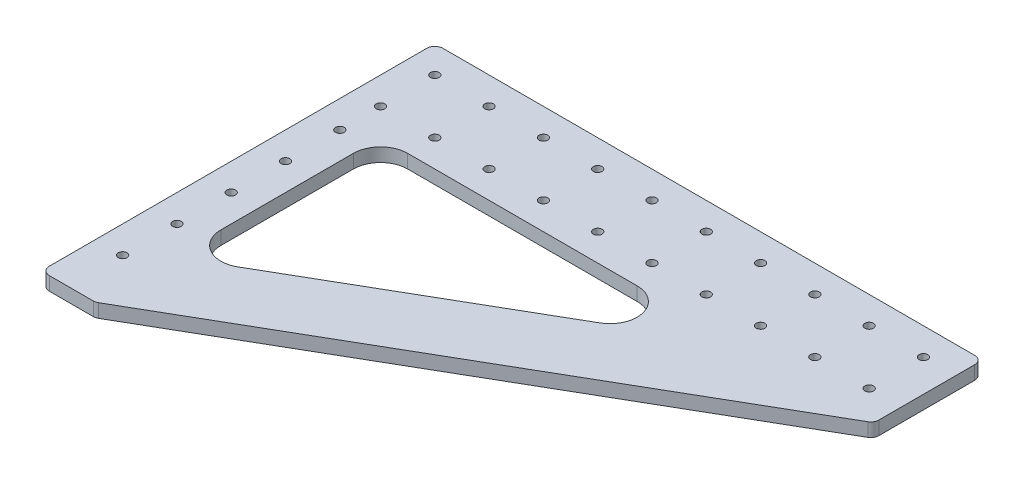
from build123d import *

# Parameters (mm, degrees)
SKETCH_1_R      = 1.6
EXTRUDE_1_DEPTH = 5
FILLET_1_R      = 10
FILLET_2_R      = 3


with BuildPart() as part:
    # 草图1 → 凸台-拉伸1 (new body)
    with BuildSketch(Plane(origin=(0, 0, 0), x_dir=(1, 0, 0), z_dir=(0, 1, 0))):
        Polygon((-20, -105), (0, -105), (181.865334795, 0), (181.865334795, 40), (-20, 40), align=None)
        with Locations((-10, -85)):
            Circle(SKETCH_1_R, mode=Mode.SUBTRACT)
        with Locations((-10, -65)):
            Circle(SKETCH_1_R, mode=Mode.SUBTRACT)
        with Locations((-10, -45)):
            Circle(SKETCH_1_R, mode=Mode.SUBTRACT)
        Polygon((131.865334795, 0), (0, -76.132486541), (0, 0), align=None, mode=Mode.SUBTRACT)
        with Locations((-10, -25)):
            Circle(SKETCH_1_R, mode=Mode.SUBTRACT)
        with Locations((-10, -5)):
            Circle(SKETCH_1_R, mode=Mode.SUBTRACT)
        with Locations((-10, 10)):
            Circle(SKETCH_1_R, mode=Mode.SUBTRACT)
        with Locations((10, 10)):
            Circle(SKETCH_1_R, mode=Mode.SUBTRACT)
        with Locations((30, 10)):
            Circle(SKETCH_1_R, mode=Mode.SUBTRACT)
        with Locations((-10, 30)):
            Circle(SKETCH_1_R, mode=Mode.SUBTRACT)
        with Locations((10, 30)):
            Circle(SKETCH_1_R, mode=Mode.SUBTRACT)
        with Locations((30, 30)):
            Circle(SKETCH_1_R, mode=Mode.SUBTRACT)
        with Locations((50, 10)):
            Circle(SKETCH_1_R, mode=Mode.SUBTRACT)
        with Locations((70, 10)):
            Circle(SKETCH_1_R, mode=Mode.SUBTRACT)
        with Locations((50, 30)):
            Circle(SKETCH_1_R, mode=Mode.SUBTRACT)
        with Locations((70, 30)):
            Circle(SKETCH_1_R, mode=Mode.SUBTRACT)
        with Locations((90, 10)):
            Circle(SKETCH_1_R, mode=Mode.SUBTRACT)
        with Locations((110, 10)):
            Circle(SKETCH_1_R, mode=Mode.SUBTRACT)
        with Locations((130, 10)):
            Circle(SKETCH_1_R, mode=Mode.SUBTRACT)
        with Locations((90, 30)):
            Circle(SKETCH_1_R, mode=Mode.SUBTRACT)
        with Locations((110, 30)):
            Circle(SKETCH_1_R, mode=Mode.SUBTRACT)
        with Locations((130, 30)):
            Circle(SKETCH_1_R, mode=Mode.SUBTRACT)
        with Locations((150, 10)):
            Circle(SKETCH_1_R, mode=Mode.SUBTRACT)
        with Locations((170, 10)):
            Circle(SKETCH_1_R, mode=Mode.SUBTRACT)
        with Locations((150, 30)):
            Circle(SKETCH_1_R, mode=Mode.SUBTRACT)
        with Locations((170, 30)):
            Circle(SKETCH_1_R, mode=Mode.SUBTRACT)
    extrude(amount=EXTRUDE_1_DEPTH)

    # 圆角1
    fillet_1_edges = [part.edges().sort_by_distance(p)[0] for p in [
        (0, 2.5, 0),
        (131.865334795, 2.5, 0),
        (0, 2.5, 76.132486541),
    ]]
    fillet(fillet_1_edges, radius=FILLET_1_R)

    # 圆角2
    fillet_2_edges = [part.edges().sort_by_distance(p)[0] for p in [
        (-20, 2.5, -40),
        (181.865334795, 2.5, -40),
        (181.865334795, 2.5, 0),
        (0, 2.5, 105),
        (-20, 2.5, 105),
    ]]
    fillet(fillet_2_edges, radius=FILLET_2_R)


solid = part.part
